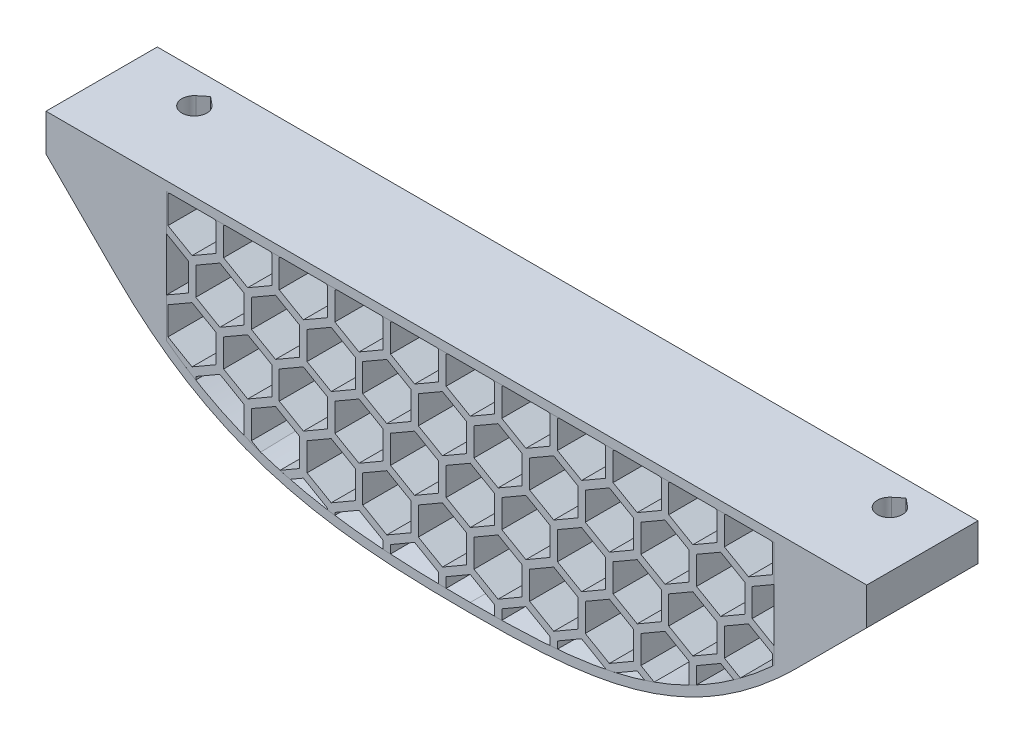
from build123d import *

# Parameters (mm, degrees)
BOSS_EXTRUDE1_DEPTH = 12
SKETCH2_R           = 1.35
CUT_EXTRUDE1_DEPTH  = 93.478375985
SKETCH4_R           = 2.5
CUT_EXTRUDE3_DEPTH  = 37
CUT_EXTRUDE4_DEPTH  = 93.478375985
CUT_EXTRUDE5_DEPTH  = 93.478375985
BOSS_EXTRUDE2_DEPTH = 12
CUT_EXTRUDE6_DEPTH  = 110.873791383
BOSS_EXTRUDE3_DEPTH = 12
FILL_START          = -12
FILL_PATTERN8_DEPTH = 12


with BuildPart() as part:
    # Sketch1 → Boss-Extrude1 (new body)
    with BuildSketch(Plane.XY):
        with BuildLine():
            Line((88.5, -40), (76.5, -40))
            Line((76.5, -40), (76.5, -44))
            add(Edge.make_bspline(
                [(76.5, -44), (76.5, -50.445206558), (58.353185223, -54), (45.75, -54)],
                knots=[0, 0, 0, 0, 1, 1, 1, 1], degree=3))
            add(Edge.make_bspline(
                [(15, -44), (15, -49.937437985), (29.668022887, -54), (45.75, -54)],
                knots=[0, 0, 0, 0, 1, 1, 1, 1], degree=3))
            Line((15, -44), (15, -40))
            Line((15, -40), (0, -40))
            Line((0, -40), (0, -44))
            Line((0, -44), (7.5, -51.5))
            add(Edge.make_bspline(
                [(7.5, -51.5), (19.073181247, -63.073181247), (31.728934499, -64), (45.75, -64)],
                knots=[0, 0, 0, 0, 1, 1, 1, 1], degree=3))
            add(Edge.make_bspline(
                [(81, -51.5), (69.44210318, -63.05789682), (59.019901197, -64), (45.75, -64)],
                knots=[0, 0, 0, 0, 1, 1, 1, 1], degree=3))
            Line((81, -51.5), (88.5, -44))
            Line((88.5, -44), (88.5, -40))
        make_face()
    extrude(amount=-BOSS_EXTRUDE1_DEPTH)

    # Sketch2 → Cut-Extrude1 (cut, through all)
    with BuildSketch(Plane(origin=(0, -40, 0), x_dir=(1, 0, 0), z_dir=(0, 1, 0))):
        with Locations(Location((82.5, 8.5, 0), (0, 0, 270))):
            Circle(SKETCH2_R)
        with Locations(Location((7.5, 8.5, 0), (0, 0, 270))):
            Circle(SKETCH2_R)
    extrude(amount=-CUT_EXTRUDE1_DEPTH, mode=Mode.SUBTRACT)

    # Sketch4 → Cut-Extrude3 (cut)
    with BuildSketch(Plane(origin=(0, -80, 0), x_dir=(1, 0, 0), z_dir=(0, 1, 0))):
        with Locations(Location((7.5, 8.5, 0), (0, 0, 270))):
            Circle(SKETCH4_R)
        with Locations(Location((82.5, 8.5, 0), (0, 0, 126.869897646))):
            Circle(SKETCH4_R)
    extrude(amount=CUT_EXTRUDE3_DEPTH, mode=Mode.SUBTRACT)

    # Sketch7 → Cut-Extrude4 (cut, through all)
    with BuildSketch(Plane(origin=(0, -40, 0), x_dir=(1, 0, 0), z_dir=(0, 1, 0))):
        with BuildLine():
            Line((7.5, 10.25), (8.359026502, 9.541428571))
            ThreePointArc((8.359026502, 9.541428571), (7.5, 9.85), (6.640973498, 9.541428571))
            Line((6.640973498, 9.541428571), (7.5, 10.25))
        make_face()
    extrude(amount=-CUT_EXTRUDE4_DEPTH, mode=Mode.SUBTRACT)

    # Sketch8 → Cut-Extrude5 (cut, through all)
    with BuildSketch(Plane(origin=(0, -40, 0), x_dir=(1, 0, 0), z_dir=(0, 1, 0))):
        with BuildLine():
            Line((82.5, 10.25), (83.359026502, 9.541428571))
            ThreePointArc((83.359026502, 9.541428571), (82.5, 9.85), (81.640973498, 9.541428571))
            Line((81.640973498, 9.541428571), (82.5, 10.25))
        make_face()
    extrude(amount=-CUT_EXTRUDE5_DEPTH, mode=Mode.SUBTRACT)

    # Sketch9 → Boss-Extrude2 (add)
    with BuildSketch(Plane.XY):
        with BuildLine():
            Line((76.5, -40), (76.5, -44))
            add(Edge.make_bspline(
                [(76.5, -44), (76.5, -50.445206558), (58.353185223, -54), (45.75, -54)],
                knots=[0, 0, 0, 0, 1, 1, 1, 1], degree=3))
            add(Edge.make_bspline(
                [(45.75, -54), (29.668022887, -54), (15, -49.937437985), (15, -44)],
                knots=[0, 0, 0, 0, 1, 1, 1, 1], degree=3))
            Line((15, -44), (15, -40))
            Line((15, -40), (76.5, -40))
        make_face()
    extrude(amount=-BOSS_EXTRUDE2_DEPTH)

    # Sketch10 → Cut-Extrude6 (cut, through all)
    with BuildSketch(Plane(origin=(0, 0, -12), x_dir=(-1, 0, 0), z_dir=(0, 0, -1))):
        with BuildLine():
            Line((-78.5, -52.50851627), (-78.5, -41))
            Line((-78.5, -41), (-13, -41))
            Line((-13, -41), (-13, -54.943005454))
            add(Edge.make_bspline(
                [(-13, -54.943005454), (-14.280903979, -55.890999143), (-15.573612137, -56.726957141), (-19.832007869, -59.133938174), (-22.8528018, -60.302913401), (-29.071357564, -61.943109564), (-32.269451303, -62.413261574), (-38.861952478, -62.941843537), (-42.255750604, -63), (-45.75, -63)],
                knots=[0.139443513, 0.139443513, 0.139443513, 0.139443513, 0.25, 0.25, 0.5, 0.5, 0.75, 0.75, 1, 1, 1, 1], degree=3))
            add(Edge.make_bspline(
                [(-45.75, -63), (-49.055642717, -63), (-52.166391163, -62.940780499), (-58.117885863, -62.411490617), (-60.957864396, -61.9421554), (-66.511454305, -60.307639757), (-69.226691055, -59.143365125), (-74.117696544, -56.160370243), (-76.28646988, -54.531288004), (-78.5, -52.50851627)],
                knots=[0, 0, 0, 0, 0.25, 0.25, 0.5, 0.5, 0.75, 0.75, 0.947092565, 0.947092565, 0.947092565, 0.947092565], degree=3))
        make_face()
    extrude(amount=-CUT_EXTRUDE6_DEPTH, mode=Mode.SUBTRACT)


with BuildPart() as body_2:
    # Sketch13 → Boss-Extrude3 (new body)
    with BuildSketch(Plane(origin=(0, 0, -12), x_dir=(-1, 0, 0), z_dir=(0, 0, -1))):
        with BuildLine():
            Line((-78.5, -41), (-13, -41))
            Line((-13, -41), (-13, -54.943005454))
            add(Edge.make_bspline(
                [(-45.75, -63), (-42.255750604, -63), (-38.861952478, -62.941843537), (-32.269451303, -62.413261574), (-29.071357564, -61.943109564), (-22.8528018, -60.302913401), (-19.832007869, -59.133938174), (-15.573612137, -56.726957141), (-14.280903979, -55.890999143), (-13, -54.943005454)],
                knots=[0.139443513, 0.139443513, 0.139443513, 0.139443513, 0.389443513, 0.389443513, 0.639443513, 0.639443513, 0.889443513, 0.889443513, 1, 1, 1, 1], degree=3))
            add(Edge.make_bspline(
                [(-78.5, -52.50851627), (-76.28646988, -54.531288004), (-74.117696544, -56.160370243), (-69.226691055, -59.143365125), (-66.511454305, -60.307639757), (-60.957864396, -61.9421554), (-58.117885863, -62.411490617), (-52.166391163, -62.940780499), (-49.055642717, -63), (-45.75, -63)],
                knots=[0, 0, 0, 0, 0.197092565, 0.197092565, 0.447092565, 0.447092565, 0.697092565, 0.697092565, 0.947092565, 0.947092565, 0.947092565, 0.947092565], degree=3))
            Line((-78.5, -52.50851627), (-78.5, -41))
        make_face()
    extrude(amount=-BOSS_EXTRUDE3_DEPTH)

    # Fill Pattern8: read off the stored shape, not the designer's step
    # Fill Pattern8 outline → Fill Pattern8 (cut)
    with BuildSketch(Plane.XY.offset(FILL_START)):
        Polygon((78.5, -44.948185145), (76.151923789, -46.303847577), (76.151923789, -49.303847577), (78.5, -50.65951001), align=None)
        Polygon((78.348076211, -41.107695155), (78.161542732, -41), (73.338457268, -41), (73.151923789, -41.107695155), (73.151923789, -44.107695155), (75.75, -45.607695155), (78.348076211, -44.107695155), align=None)
        with BuildLine():
            add(Edge.make_bspline(
                [(78.348076208, -52.646793656), (77.183051451, -53.702924642), (76.030243819, -54.650303858), (74.884961244, -55.500569641)],
                knots=[0.057418605, 0.057418605, 0.057418605, 0.057418605, 0.161247643, 0.161247643, 0.161247643, 0.161247643], degree=3))
            Line((78.348076208, -52.646793656), (78.348076211, -51.5))
            Line((78.348076211, -51.5), (75.75, -50))
            Line((75.75, -50), (73.151923789, -51.5))
            Line((73.151923789, -51.5), (73.151923789, -54.5))
            Line((73.151923789, -54.5), (74.884961244, -55.500569641))
        make_face()
        Polygon((72.348076211, -41.107695155), (72.161542732, -41), (67.338457268, -41), (67.151923789, -41.107695155), (67.151923789, -44.107695155), (69.75, -45.607695155), (72.348076211, -44.107695155), align=None)
        with BuildLine():
            add(Edge.make_bspline(
                [(74.172739507, -56.01757146), (73.433368189, -56.542121735), (72.696741204, -57.027002373), (71.357698498, -57.84367648), (70.754769085, -58.187424452), (70.151923789, -58.508299848)],
                knots=[0.182798634, 0.182798634, 0.182798634, 0.182798634, 0.25, 0.25, 0.305202103, 0.305202103, 0.305202103, 0.305202103], degree=3))
            Line((74.172739507, -56.01757146), (72.75, -55.196152423))
            Line((72.75, -55.196152423), (70.151923789, -56.696152423))
            Line((70.151923789, -56.696152423), (70.151923789, -58.508299848))
        make_face()
        Polygon((66.348076211, -41.107695155), (66.161542732, -41), (61.338457268, -41), (61.151923789, -41.107695155), (61.151923789, -44.107695155), (63.75, -45.607695155), (66.348076211, -44.107695155), align=None)
        with BuildLine():
            add(Edge.make_bspline(
                [(69.348076211, -58.92274114), (68.097898745, -59.54659654), (66.846412148, -60.075341207), (65.585822101, -60.524014)],
                knots=[0.329737193, 0.329737193, 0.329737193, 0.329737193, 0.444196431, 0.444196431, 0.444196431, 0.444196431], degree=3))
            Line((69.348076211, -58.92274114), (69.348076211, -56.696152423))
            Line((69.348076211, -56.696152423), (66.75, -55.196152423))
            Line((66.75, -55.196152423), (64.151923789, -56.696152423))
            Line((64.151923789, -56.696152423), (64.151923789, -59.696152423))
            Line((64.151923789, -59.696152423), (65.585822101, -60.524014))
        make_face()
        Polygon((60.348076211, -41.107695155), (60.161542732, -41), (55.338457268, -41), (55.151923789, -41.107695155), (55.151923789, -44.107695155), (57.75, -45.607695155), (60.348076211, -44.107695155), align=None)
        with BuildLine():
            add(Edge.make_bspline(
                [(64.57235234, -60.86709019), (64.293691079, -60.956656987), (64.014487788, -61.042539326), (62.980176402, -61.346954699), (62.221028841, -61.543325973), (61.455760657, -61.716884548)],
                knots=[0.474806527, 0.474806527, 0.474806527, 0.474806527, 0.5, 0.5, 0.567927499, 0.567927499, 0.567927499, 0.567927499], degree=3))
            Line((64.57235234, -60.86709019), (63.75, -60.392304845))
            Line((63.75, -60.392304845), (61.455760657, -61.716884548))
        make_face()
        Polygon((54.348076211, -41.107695155), (54.161542732, -41), (49.338457268, -41), (49.151923789, -41.107695155), (49.151923789, -44.107695155), (51.75, -45.607695155), (54.348076211, -44.107695155), align=None)
        with BuildLine():
            add(Edge.make_bspline(
                [(60.348076211, -61.95161647), (58.654048064, -62.286027712), (56.92713556, -62.517104329), (55.151923789, -62.675264534)],
                knots=[0.600571049, 0.600571049, 0.600571049, 0.600571049, 0.749725958, 0.749725958, 0.749725958, 0.749725958], degree=3))
            Line((60.348076211, -61.95161647), (60.348076211, -61.892304845))
            Line((60.348076211, -61.892304845), (57.75, -60.392304845))
            Line((57.75, -60.392304845), (55.151923789, -61.892304845))
            Line((55.151923789, -61.892304845), (55.151923789, -62.675264534))
        make_face()
        Polygon((48.348076211, -41.107695155), (48.161542732, -41), (43.338457268, -41), (43.151923789, -41.107695155), (43.151923789, -44.107695155), (45.75, -45.607695155), (48.348076211, -44.107695155), align=None)
        with BuildLine():
            add(Edge.make_bspline(
                [(54.348076211, -62.741733543), (52.663779535, -62.870518039), (50.935261283, -62.93863924), (49.151923789, -62.971967232)],
                knots=[0.772146882, 0.772146882, 0.772146882, 0.772146882, 0.912498566, 0.912498566, 0.912498566, 0.912498566], degree=3))
            Line((54.348076211, -62.741733543), (54.348076211, -61.892304845))
            Line((54.348076211, -61.892304845), (51.75, -60.392304845))
            Line((51.75, -60.392304845), (49.151923789, -61.892304845))
            Line((49.151923789, -61.892304845), (49.151923789, -62.971967232))
        make_face()
        Polygon((42.348076211, -41.107695155), (42.161542732, -41), (37.338457268, -41), (37.151923789, -41.107695155), (37.151923789, -44.107695155), (39.75, -45.607695155), (42.348076211, -44.107695155), align=None)
        with BuildLine():
            add(Edge.make_bspline(
                [(43.151923789, -62.986825993), (44.011719664, -62.996375968), (44.877730011, -63), (46.629443891, -63), (47.49509336, -62.995808503), (48.348076211, -62.98467241)],
                knots=[0, 0, 0, 0, 0.062407537, 0.062407537, 0.125328338, 0.125328338, 0.125328338, 0.125328338], degree=3))
            Line((48.348076211, -62.98467241), (48.348076211, -61.892304845))
            Line((48.348076211, -61.892304845), (45.75, -60.392304845))
            Line((45.75, -60.392304845), (43.151923789, -61.892304845))
            Line((43.151923789, -61.892304845), (43.151923789, -62.986825993))
        make_face()
        Polygon((36.348076211, -41.107695155), (36.161542732, -41), (31.338457268, -41), (31.151923789, -41.107695155), (31.151923789, -44.107695155), (33.75, -45.607695155), (36.348076211, -44.107695155), align=None)
        with BuildLine():
            add(Edge.make_bspline(
                [(42.348076211, -62.976072696), (40.589996356, -62.948391675), (38.858076029, -62.892675452), (37.151923789, -62.788975651)],
                knots=[0.08190037, 0.08190037, 0.08190037, 0.08190037, 0.210087201, 0.210087201, 0.210087201, 0.210087201], degree=3))
            Line((42.348076211, -62.976072696), (42.348076211, -61.892304845))
            Line((42.348076211, -61.892304845), (39.75, -60.392304845))
            Line((39.75, -60.392304845), (37.151923789, -61.892304845))
            Line((37.151923789, -61.892304845), (37.151923789, -62.788975651))
        make_face()
        Polygon((30.348076211, -41.107695155), (30.161542732, -41), (25.338457268, -41), (25.151923789, -41.107695155), (25.151923789, -44.107695155), (27.75, -45.607695155), (30.348076211, -44.107695155), align=None)
        with BuildLine():
            add(Edge.make_bspline(
                [(36.348076211, -62.73635631), (36.086676056, -62.717990849), (35.825885092, -62.698413856), (34.074645897, -62.558000767), (32.603674729, -62.396325755), (31.151923789, -62.179191073)],
                knots=[0.230266731, 0.230266731, 0.230266731, 0.230266731, 0.25, 0.25, 0.363087276, 0.363087276, 0.363087276, 0.363087276], degree=3))
            Line((36.348076211, -62.73635631), (36.348076211, -61.892304845))
            Line((36.348076211, -61.892304845), (33.75, -60.392304845))
            Line((33.75, -60.392304845), (31.151923789, -61.892304845))
            Line((31.151923789, -61.892304845), (31.151923789, -62.179191073))
        make_face()
        Polygon((24.348076211, -41.107695155), (24.161542732, -41), (19.338457268, -41), (19.151923789, -41.107695155), (19.151923789, -44.107695155), (21.75, -45.607695155), (24.348076211, -44.107695155), align=None)
        with BuildLine():
            add(Edge.make_bspline(
                [(30.348076211, -62.052887106), (28.989627044, -61.828984233), (27.648030958, -61.553862125), (26.322569102, -61.216432458)],
                knots=[0.384010868, 0.384010868, 0.384010868, 0.384010868, 0.490348997, 0.490348997, 0.490348997, 0.490348997], degree=3))
            Line((30.348076211, -62.052887106), (30.348076211, -61.892304845))
            Line((30.348076211, -61.892304845), (27.75, -60.392304845))
            Line((27.75, -60.392304845), (26.322569102, -61.216432458))
        make_face()
        Polygon((18.348076211, -41.107695155), (18.161542732, -41), (13.338457268, -41), (13.151923789, -41.107695155), (13.151923789, -44.107695155), (15.75, -45.607695155), (18.348076211, -44.107695155), align=None)
        with BuildLine():
            add(Edge.make_bspline(
                [(25.225449348, -60.921651614), (24.531597649, -60.725230418), (23.842110991, -60.51067876), (23.15676023, -60.276295012)],
                knots=[0.519787101, 0.519787101, 0.519787101, 0.519787101, 0.575826063, 0.575826063, 0.575826063, 0.575826063], degree=3))
            Line((25.225449348, -60.921651614), (27.348076211, -59.696152423))
            Line((27.348076211, -59.696152423), (27.348076211, -56.696152423))
            Line((27.348076211, -56.696152423), (24.75, -55.196152423))
            Line((24.75, -55.196152423), (22.151923789, -56.696152423))
            Line((22.151923789, -56.696152423), (22.151923789, -59.696152423))
            Line((22.151923789, -59.696152423), (23.15676023, -60.276295012))
        make_face()
        Polygon((15.348076211, -46.303847577), (13, -44.948185145), (13, -50.65951001), (15.348076211, -49.303847577), align=None)
        with BuildLine():
            add(Edge.make_bspline(
                [(21.348076211, -59.606771975), (19.839891371, -59.00459941), (18.35115685, -58.296913965), (16.636428028, -57.327694566), (16.393954321, -57.186996784), (16.151923789, -57.042819106)],
                knots=[0.625383002, 0.625383002, 0.625383002, 0.625383002, 0.75, 0.75, 0.770568335, 0.770568335, 0.770568335, 0.770568335], degree=3))
            Line((21.348076211, -59.606771975), (21.348076211, -56.696152423))
            Line((21.348076211, -56.696152423), (18.75, -55.196152423))
            Line((18.75, -55.196152423), (16.151923789, -56.696152423))
            Line((16.151923789, -56.696152423), (16.151923789, -57.042819106))
        make_face()
        Polygon((60.75, -55.196152423), (58.151923789, -56.696152423), (58.151923789, -59.696152423), (60.75, -61.196152423), (63.348076211, -59.696152423), (63.348076211, -56.696152423), align=None)
        Polygon((69.75, -50), (67.151923789, -51.5), (67.151923789, -54.5), (69.75, -56), (72.348076211, -54.5), (72.348076211, -51.5), align=None)
        Polygon((15.75, -50), (13.151923789, -51.5), (13.151923789, -54.5), (15.75, -56), (18.348076211, -54.5), (18.348076211, -51.5), align=None)
        Polygon((24.75, -44.803847577), (22.151923789, -46.303847577), (22.151923789, -49.303847577), (24.75, -50.803847577), (27.348076211, -49.303847577), (27.348076211, -46.303847577), align=None)
        Polygon((45.348076211, -46.303847577), (42.75, -44.803847577), (40.151923789, -46.303847577), (40.151923789, -49.303847577), (42.75, -50.803847577), (45.348076211, -49.303847577), align=None)
        Polygon((54.348076211, -51.5), (51.75, -50), (49.151923789, -51.5), (49.151923789, -54.5), (51.75, -56), (54.348076211, -54.5), align=None)
        Polygon((36.348076211, -54.5), (36.348076211, -51.5), (33.75, -50), (31.151923789, -51.5), (31.151923789, -54.5), (33.75, -56), align=None)
        Polygon((18.75, -44.803847577), (16.151923789, -46.303847577), (16.151923789, -49.303847577), (18.75, -50.803847577), (21.348076211, -49.303847577), (21.348076211, -46.303847577), align=None)
        Polygon((48.348076211, -51.5), (45.75, -50), (43.151923789, -51.5), (43.151923789, -54.5), (45.75, -56), (48.348076211, -54.5), align=None)
        Polygon((39.348076211, -46.303847577), (36.75, -44.803847577), (34.151923789, -46.303847577), (34.151923789, -49.303847577), (36.75, -50.803847577), (39.348076211, -49.303847577), align=None)
        Polygon((57.348076211, -56.696152423), (54.75, -55.196152423), (52.151923789, -56.696152423), (52.151923789, -59.696152423), (54.75, -61.196152423), (57.348076211, -59.696152423), align=None)
        Polygon((30.348076211, -54.5), (30.348076211, -51.5), (27.75, -50), (25.151923789, -51.5), (25.151923789, -54.5), (27.75, -56), align=None)
        Polygon((42.348076211, -51.5), (39.75, -50), (37.151923789, -51.5), (37.151923789, -54.5), (39.75, -56), (42.348076211, -54.5), align=None)
        Polygon((33.348076211, -46.303847577), (30.75, -44.803847577), (28.151923789, -46.303847577), (28.151923789, -49.303847577), (30.75, -50.803847577), (33.348076211, -49.303847577), align=None)
        Polygon((51.348076211, -56.696152423), (48.75, -55.196152423), (46.151923789, -56.696152423), (46.151923789, -59.696152423), (48.75, -61.196152423), (51.348076211, -59.696152423), align=None)
        Polygon((24.348076211, -54.5), (24.348076211, -51.5), (21.75, -50), (19.151923789, -51.5), (19.151923789, -54.5), (21.75, -56), align=None)
        Polygon((45.348076211, -56.696152423), (42.75, -55.196152423), (40.151923789, -56.696152423), (40.151923789, -59.696152423), (42.75, -61.196152423), (45.348076211, -59.696152423), align=None)
        Polygon((54.75, -44.803847577), (52.151923789, -46.303847577), (52.151923789, -49.303847577), (54.75, -50.803847577), (57.348076211, -49.303847577), (57.348076211, -46.303847577), align=None)
        Polygon((36.75, -55.196152423), (34.151923789, -56.696152423), (34.151923789, -59.696152423), (36.75, -61.196152423), (39.348076211, -59.696152423), (39.348076211, -56.696152423), align=None)
        Polygon((75.348076211, -46.303847577), (72.75, -44.803847577), (70.151923789, -46.303847577), (70.151923789, -49.303847577), (72.75, -50.803847577), (75.348076211, -49.303847577), align=None)
        Polygon((66.348076211, -54.5), (66.348076211, -51.5), (63.75, -50), (61.151923789, -51.5), (61.151923789, -54.5), (63.75, -56), align=None)
        Polygon((48.75, -44.803847577), (46.151923789, -46.303847577), (46.151923789, -49.303847577), (48.75, -50.803847577), (51.348076211, -49.303847577), (51.348076211, -46.303847577), align=None)
        Polygon((30.75, -55.196152423), (28.151923789, -56.696152423), (28.151923789, -59.696152423), (30.75, -61.196152423), (33.348076211, -59.696152423), (33.348076211, -56.696152423), align=None)
        Polygon((69.348076211, -46.303847577), (66.75, -44.803847577), (64.151923789, -46.303847577), (64.151923789, -49.303847577), (66.75, -50.803847577), (69.348076211, -49.303847577), align=None)
        Polygon((60.348076211, -54.5), (60.348076211, -51.5), (57.75, -50), (55.151923789, -51.5), (55.151923789, -54.5), (57.75, -56), align=None)
        Polygon((63.348076211, -46.303847577), (60.75, -44.803847577), (58.151923789, -46.303847577), (58.151923789, -49.303847577), (60.75, -50.803847577), (63.348076211, -49.303847577), align=None)
    extrude(amount=FILL_PATTERN8_DEPTH, mode=Mode.SUBTRACT)


solid = Compound([part.part, body_2.part])
